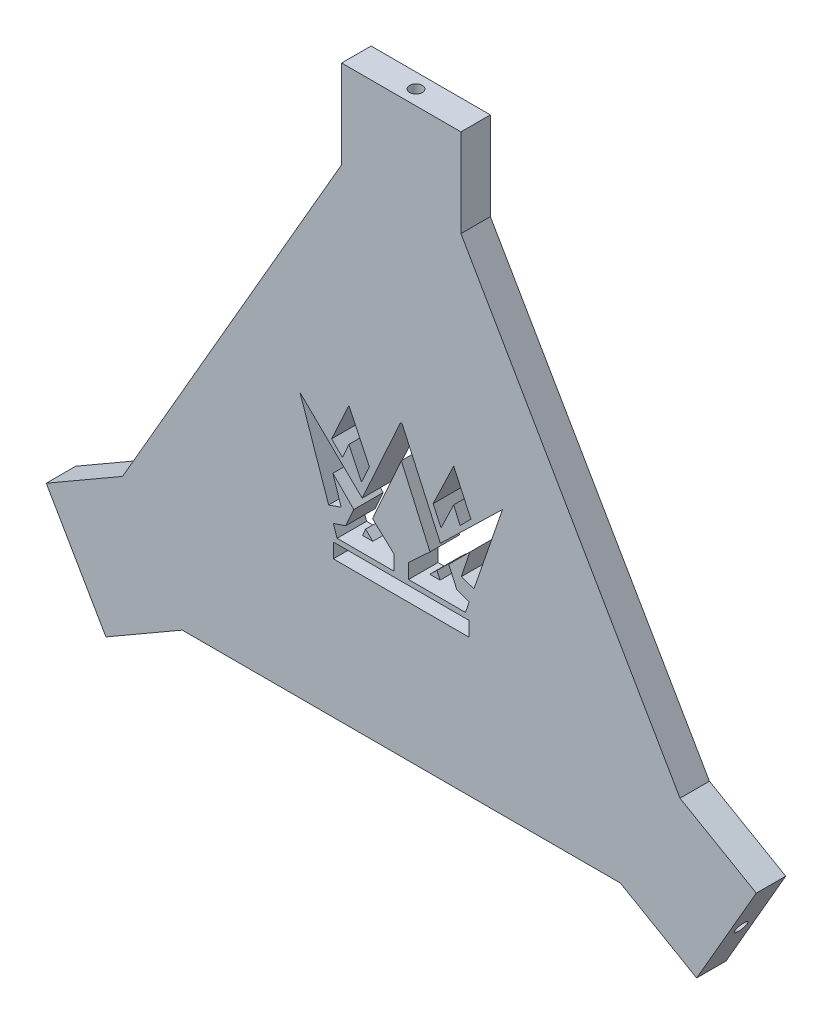
from build123d import *

# Parameters (mm, degrees)
BOSS_EXTRUDE1_DEPTH    = 3.5
SKETCH7_R              = 1.5
CUT_EXTRUDE2_DEPTH     = 5
SKETCH8_R              = 1.5
CUT_EXTRUDE3_DEPTH     = 5
CIRPATTERN2_COUNT      = 3
SKETCH10_R             = 1.5
CUT_EXTRUDE4_DEPTH     = 5
CUT_EXTRUDE6_START     = -3.5
CUT_EXTRUDE6_OUTLINE_W = 32.331955976
CUT_EXTRUDE6_OUTLINE_H = 3.460853055
CUT_EXTRUDE6_DEPTH     = 7


# Read off the part's stored shape, not the designer's step: Cut-Extrude6
with BuildPart() as part:
    # Sketch5 → Boss-Extrude1 (new, symmetric)
    with BuildSketch(Plane.XY):
        Polygon((-90.941420321, 147.425432766), (-90.941420321, 168.383482689), (-62.564539335, 168.383482689), (-62.564539335, 147.425432766), (-10.458602513, 57.175302815), (7.691601133, 46.696277854), (-6.49683936, 22.12117804), (-24.647043006, 32.600203001), (-128.85891665, 32.600203001), (-147.009120296, 22.12117804), (-161.197560789, 46.696277854), (-143.047357143, 57.175302815), align=None)
    extrude(amount=BOSS_EXTRUDE1_DEPTH, both=True)

    # Sketch7 → Cut-Extrude2 (cut)
    with BuildSketch(Plane(origin=(-14.451380592, 8.343508475, 0), x_dir=(0, 0, -1), z_dir=(0.8660254037844364, -0.5000000000000041, 0))):
        with Locations(Location((0, 30.097522957, 0), (0, 0, 90))):
            Circle(SKETCH7_R)
    extrude(amount=-CUT_EXTRUDE2_DEPTH, mode=Mode.SUBTRACT)

    # Sketch8 → Cut-Extrude3 (cut)
    with BuildSketch(Plane(origin=(-100.67808915, -58.126521872, 0), x_dir=(0, 0, 1), z_dir=(-0.8660254037844431, -0.49999999999999245, 0))):
        with Locations(Location((0, 106.850502785, 0), (0, 0, 270))):
            Circle(SKETCH8_R)
    cut_extrude3 = extrude(amount=-CUT_EXTRUDE3_DEPTH, mode=Mode.SUBTRACT)

    # CirPattern2: Cut-Extrude3 ×3 about axis
    cirpattern2_axis = Axis((-73.590173973, 82.29390331, -173.325842425), (0, 0, 1))
    for i in range(1, CIRPATTERN2_COUNT):
        add(cut_extrude3.rotate(cirpattern2_axis, i * 360 / CIRPATTERN2_COUNT), mode=Mode.SUBTRACT)

    # Sketch10 → Cut-Extrude4 (cut)
    with BuildSketch(Plane(origin=(0, 168.383482689, 0), x_dir=(1, 0, 0), z_dir=(0, 1, 0))):
        with Locations(Location((-76.752979828, 0, 0), (0, 0, 270))):
            Circle(SKETCH10_R)
    extrude(amount=-CUT_EXTRUDE4_DEPTH, mode=Mode.SUBTRACT)

    # Cut-Extrude6 outline → Cut-Extrude6 (cut)
    # profile 1 of 4: a face of its own
    with BuildSketch(Plane.XY.offset(CUT_EXTRUDE6_START)):
        Polygon((-76.948691213, 101.287582971), (-86.056353801, 81.184584586), (-100.832316407, 95.538376831), (-94.032857208, 75.793793389), (-91.051568615, 76.820462308), (-93.021355851, 82.839256642), (-88.039745602, 77.857646392), (-89.981729258, 73.551508719), (-92.913050535, 72.542047087), (-92.015211095, 69.934859484), (-78.477180663, 69.934859484), (-78.477180663, 73.460729214), (-83.5906503, 78.186442564), (-76.752979828, 93.555750632), (-69.915309356, 78.186442564), (-75.028778993, 73.460729214), (-75.028778993, 69.934859484), (-61.490748561, 69.934859484), (-60.592909121, 72.542047087), (-63.524230398, 73.551508719), (-65.466214054, 77.857646392), (-60.484603805, 82.839256642), (-62.454391041, 76.820462308), (-59.473102448, 75.793793389), (-52.673643249, 95.538376831), (-67.449605855, 81.184584586), (-76.557268443, 101.287582971), align=None)
        Polygon((-83.525690609, 73.550911585), (-85.963086807, 73.550911585), (-85.254252198, 75.209756113), align=None, mode=Mode.SUBTRACT)
        Polygon((-68.251707458, 75.209756113), (-67.542872849, 73.550911585), (-69.980269047, 73.550911585), align=None, mode=Mode.SUBTRACT)
    # profile 2 of 4: a face of its own
    with BuildSketch(Plane.XY.offset(CUT_EXTRUDE6_START)):
        Polygon((-69.175827244, 88.491814683), (-67.297925544, 84.413543316), (-64.289758699, 90.689055224), (-62.769327814, 87.191919697), (-60.190430004, 89.782344087), (-64.289758699, 98.684926605), align=None)
    # profile 3 of 4: a face of its own
    with BuildSketch(Plane.XY.offset(CUT_EXTRUDE6_START)):
        with Locations((-76.752979828, 66.985702835)):
            Rectangle(CUT_EXTRUDE6_OUTLINE_W, CUT_EXTRUDE6_OUTLINE_H)
    # profile 4 of 4: a face of its own
    with BuildSketch(Plane.XY.offset(CUT_EXTRUDE6_START)):
        Polygon((-93.315529652, 89.782344087), (-90.736631842, 87.191919697), (-89.216200957, 90.689055224), (-86.208034112, 84.413543316), (-84.330132412, 88.491814683), (-89.216200957, 98.684926605), align=None)
    extrude(amount=CUT_EXTRUDE6_DEPTH, mode=Mode.SUBTRACT)


solid = part.part
